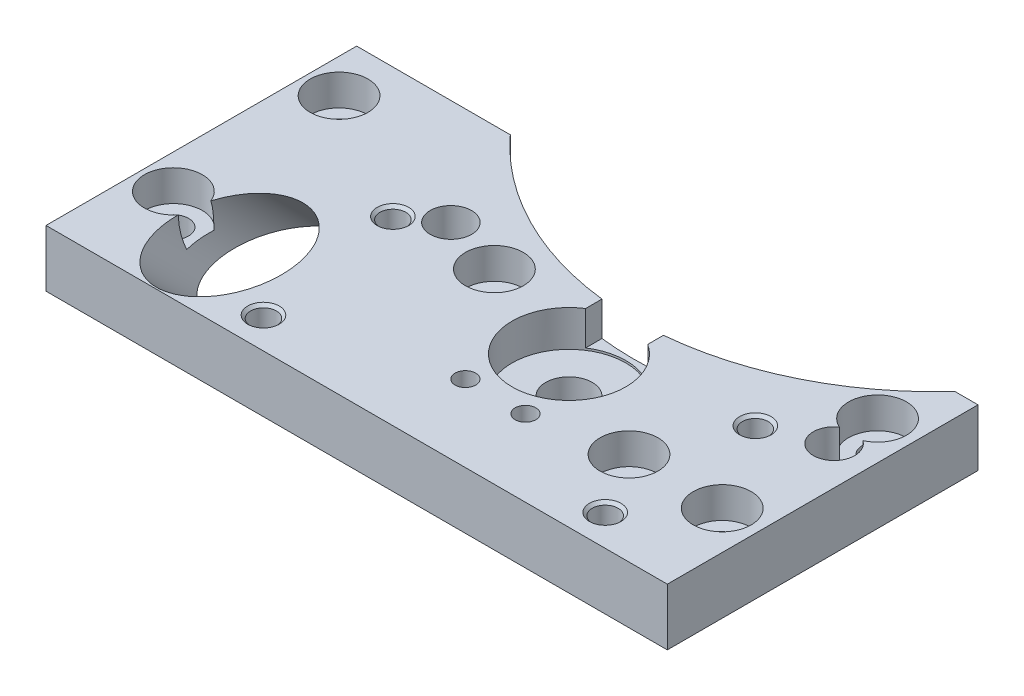
from build123d import *

# Parameters (mm, degrees)
SKETCH_1_W                 = 60
SKETCH_1_H                 = 30
EXTRUDE_1_DEPTH            = 5.5
HOLE_WIZARD_41_D           = 2.9464
HOLE_WIZARD_41_CBORE_D     = 5.588
HOLE_WIZARD_41_CBORE_DEPTH = 2.9972
CUT_EXTRUDE_START          = -5.5
CUT_EXTRUDE_1_OUTLINE_R    = 2.25
CUT_EXTRUDE_1_OUTLINE_R_2  = 2
CUT_EXTRUDE_1_OUTLINE_R_3  = 1
CUT_EXTRUDE_1_DEPTH        = 5.5
CUT_EXTRUDE_START_2        = -3.5
SKETCH_4_3_R               = 5.5
SKETCH_4_3_R_2             = 2.25
CUT_EXTRUDE_2_DEPTH        = 3.5
CUT_EXTRUDE_START_3        = -3.3
CUT_EXTRUDE_3_DEPTH        = 3.3
HOLE_WIZARD_M3_AT_2_COUNT  = 2
HOLE_WIZARD_M3_AT_2_PITCH  = 14.637281168
HOLE_WIZARD_M3_AT_3_COUNT  = 2
HOLE_WIZARD_M3_AT_3_PITCH  = 36.045110625
HOLE_WIZARD_M3_AT_4_COUNT  = 2
HOLE_WIZARD_M3_AT_4_PITCH  = 33
SKETCH_7_R                 = 5
CUT_EXTRUDE_4_DEPTH        = 69.411439102


# Read off the part's stored shape, not the designer's step: Вырез-Вытянуть1
with BuildPart() as part:
    # Эскиз1 → Бобышка-Вытянуть1 (new body)
    with BuildSketch(Plane(origin=(0, 0, 0), x_dir=(1, 0, 0), z_dir=(0, 1, 0))):
        with Locations((30, 15)):
            Rectangle(SKETCH_1_W, SKETCH_1_H)
    extrude(amount=EXTRUDE_1_DEPTH)

    # Цековка для  винта с внутренним шестигранником #41 (through all)
    with Locations(Plane(origin=(0, 5.5, 0), x_dir=(-1, 0, 0), z_dir=(0, 1, 0))):
        with Locations((-47.3, -9), (-3.3, -9), (-25.3, -18), (-3.3, -25), (-56.3, -9), (-56.3, -24)):
            CounterBoreHole(HOLE_WIZARD_41_D / 2, HOLE_WIZARD_41_CBORE_D / 2, HOLE_WIZARD_41_CBORE_DEPTH)

    # Вырез-Вытянуть1 outline → Вырез-Вытянуть1 (cut)
    with BuildSketch(Plane(origin=(0, 5.5, 0), x_dir=(1, 0, 0), z_dir=(0, 1, 0)).offset(CUT_EXTRUDE_START)):
        with BuildLine():
            Line((57.765087934, 30), (14.834912066, 30))
            ThreePointArc((14.834912066, 30), (36.3, 20.5), (57.765087934, 30))
        make_face()
        with Locations((36, 14.5)):
            Circle(CUT_EXTRUDE_1_OUTLINE_R)
        with Locations((19.3, 19.8)):
            Circle(CUT_EXTRUDE_1_OUTLINE_R_2)
        with Locations((33.1, 7.4)):
            Circle(CUT_EXTRUDE_1_OUTLINE_R_3)
        with Locations((38.9, 7.4)):
            Circle(CUT_EXTRUDE_1_OUTLINE_R_3)
        with Locations((56.3, 19.8)):
            Circle(CUT_EXTRUDE_1_OUTLINE_R_2)
    extrude(amount=CUT_EXTRUDE_1_DEPTH, mode=Mode.SUBTRACT)

    # Эскиз4<3> → Вырез-Вытянуть2 (cut)
    with BuildSketch(Plane(origin=(0, 5.5, 0), x_dir=(1, 0, 0), z_dir=(0, 1, 0)).offset(CUT_EXTRUDE_START_2)):
        with Locations(Location((36, 14.5, 0), (0, 0, 270))):
            Circle(SKETCH_4_3_R)
        with Locations(Location((36, 14.5, 0), (0, 0, 270))):
            Circle(SKETCH_4_3_R_2, mode=Mode.SUBTRACT)
    extrude(amount=CUT_EXTRUDE_2_DEPTH, mode=Mode.SUBTRACT)

    # Эскиз4<4> → Вырез-Вытянуть3 (cut)
    with BuildSketch(Plane(origin=(0, 5.5, 0), x_dir=(1, 0, 0), z_dir=(0, 1, 0)).offset(CUT_EXTRUDE_START_3)):
        with BuildLine():
            Line((39, 19.109772229), (39, 20.62596322))
            ThreePointArc((39, 20.62596322), (35.998381592, 20.501568554), (33, 20.688370404))
            Line((33, 20.688370404), (33, 19.109772229))
            ThreePointArc((33, 19.109772229), (36, 20), (39, 19.109772229))
        make_face()
    extrude(amount=CUT_EXTRUDE_3_DEPTH, mode=Mode.SUBTRACT)

    # Эскиз5 → M3_для_платы (revolve, cut)
    with BuildSketch(Plane(origin=(18, 5.5, -3), x_dir=(0, 0, 1), z_dir=(1, 0, 0))):
        Polygon((0, 0), (0, 5.5), (1.525, 5.5), (1.25, 5.225), (1.25, 0.275), (1.525, 0), align=None)
    hole_wizard_m3 = revolve(axis=Axis((18, 11.85, -3), (0, -1, 0)), mode=Mode.SUBTRACT)

    # M3_для_платы at 2: M3_для_платы ×2
    with Locations(*[Vector(-0.1366373971370308, 0, -0.9906211292434749) * (i * HOLE_WIZARD_M3_AT_2_PITCH) for i in range(1, HOLE_WIZARD_M3_AT_2_COUNT)]):
        add(hole_wizard_m3, mode=Mode.SUBTRACT)

    # M3_для_платы at 3: M3_для_платы ×2
    with Locations(*[Vector(0.9155194540230326, 0, -0.40227369949496883) * (i * HOLE_WIZARD_M3_AT_3_PITCH) for i in range(1, HOLE_WIZARD_M3_AT_3_COUNT)]):
        add(hole_wizard_m3, mode=Mode.SUBTRACT)

    # M3_для_платы at 4: M3_для_платы ×2
    with Locations(*[(i * HOLE_WIZARD_M3_AT_4_PITCH, 0, 0) for i in range(1, HOLE_WIZARD_M3_AT_4_COUNT)]):
        add(hole_wizard_m3, mode=Mode.SUBTRACT)

    # Эскиз7 → Вырез-Вытянуть4 (cut, through all)
    with BuildSketch(Plane(origin=(0, 2.75, 2.75), x_dir=(-1, 0, 0), z_dir=(0, 0.7071067811865462, 0.7071067811865488))):
        with Locations(Location((-10.5, -9, 0), (0, 0, 90))):
            Circle(SKETCH_7_R)
    extrude(amount=-CUT_EXTRUDE_4_DEPTH, mode=Mode.SUBTRACT)


solid = part.part
